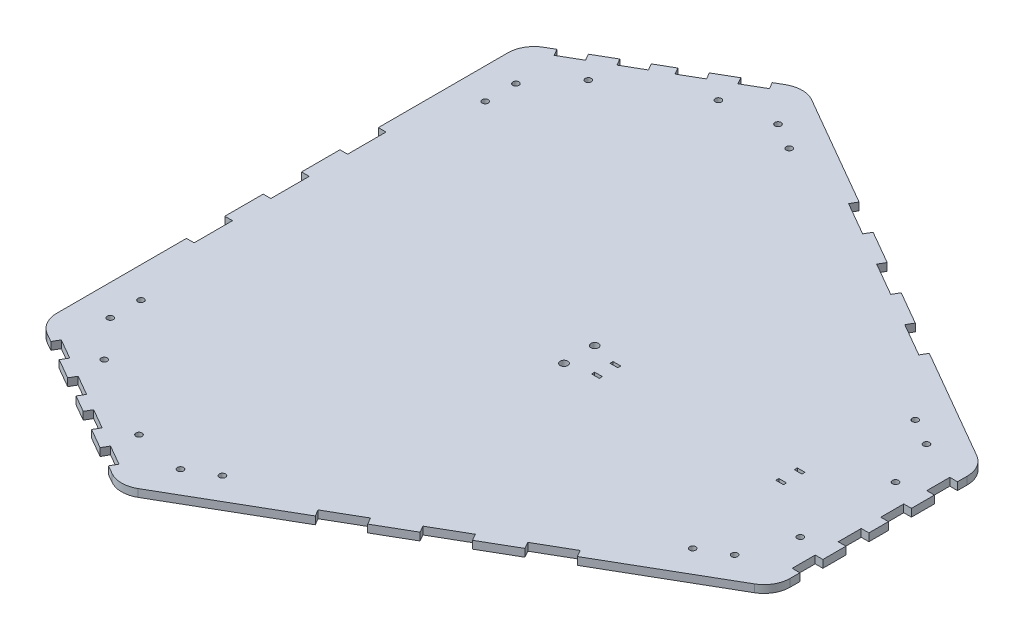
from build123d import *

# Parameters (mm, degrees)
STOCK_FRAME_START              = 460
STOCK_FRAME_MASTER_1_OUTLINE_R = 2
STOCK_FRAME_MASTER_1_DEPTH     = 5
SKETCH4_R                      = 2
CUT_EXTRUDE3_DEPTH             = 262.655447486
SKETCH1_R                      = 2.5
CUT_EXTRUDE1_DEPTH             = 313.332847009
SKETCH2_W                      = 5
SKETCH2_H                      = 2
CUT_EXTRUDE2_DEPTH             = 313.332847009


# Read off the part's stored shape, not the designer's step: Stock-Frame master-1
with BuildPart() as part:
    # Stock-Frame master-1 outline → Stock-Frame master-1 (new body)
    with BuildSketch(Plane(origin=(0, 0, 0), x_dir=(1, 0, 0), z_dir=(0, 1, 0)).offset(STOCK_FRAME_START)):
        with BuildLine():
            Line((220, 51.342522712), (220, 57.685045424))
            ThreePointArc((220, 57.685045424), (217.722431864, 66.185045424), (211.5, 72.407477288))
            Line((211.5, 72.407477288), (138.354945114, 114.637794416))
            Line((138.354945114, 114.637794416), (135.854945114, 110.307667397))
            Line((135.854945114, 110.307667397), (114.20431002, 122.807667397))
            Line((114.20431002, 122.807667397), (116.70431002, 127.137794416))
            Line((116.70431002, 127.137794416), (95.053674925, 139.637794416))
            Line((95.053674925, 139.637794416), (92.553674925, 135.307667397))
            Line((92.553674925, 135.307667397), (81.728357378, 141.557667397))
            Line((81.728357378, 141.557667397), (0, 0))
            Line((0, 0), (220, 0))
            Line((220, 0), (220, 6.342522712))
            Line((220, 6.342522712), (215, 6.342522712))
            Line((215, 6.342522712), (215, 21.342522712))
            Line((215, 21.342522712), (220, 21.342522712))
            Line((220, 21.342522712), (220, 36.342522712))
            Line((220, 36.342522712), (215, 36.342522712))
            Line((215, 36.342522712), (215, 51.342522712))
            Line((215, 51.342522712), (220, 51.342522712))
        make_face()
        with Locations((188.660254038, 62.5)):
            Circle(STOCK_FRAME_MASTER_1_OUTLINE_R, mode=Mode.SUBTRACT)
        with Locations((171.339745962, 72.5)):
            Circle(STOCK_FRAME_MASTER_1_OUTLINE_R, mode=Mode.SUBTRACT)
    extrude(amount=STOCK_FRAME_MASTER_1_DEPTH)

    # Sketch4 → Cut-Extrude3 (cut, through all)
    with BuildSketch(Plane(origin=(0, 465, 0), x_dir=(1, 0, 0), z_dir=(0, 1, 0))):
        with Locations(Location((200, 31, 0), (0, 0, 270))):
            Circle(SKETCH4_R)
    extrude(amount=-CUT_EXTRUDE3_DEPTH, mode=Mode.SUBTRACT)

    # Mirror1: part across plane


with BuildPart() as part_1:
    add(part.part)
    add(part.part.mirror(Plane(origin=(0, 465, 0), x_dir=(1, 0, 0), z_dir=(0, 0, -1))))


with BuildPart() as body_2:
    # Mirror2: mirrored copy
    add(part_1.part.mirror(Plane(origin=(81.728357378, 465, -141.557667397), x_dir=(-0.49999999999999395, 0, 0.866025403784442), z_dir=(0.8660254037844421, 0, 0.49999999999999395))))


with BuildPart() as body_3:
    # Mirror3: mirrored copy
    add(part_1.part.mirror(Plane(origin=(81.728357378, 465, 141.557667397), x_dir=(0.49999999999999395, 0, 0.866025403784442), z_dir=(0.8660254037844421, 0, -0.49999999999999395))))

    # Combine1: union body 2, part
    add(body_2.part)
    add(part_1.part)

    # Sketch1 → Cut-Extrude1 (cut, through all)
    with BuildSketch(Plane(origin=(0, 465, 0), x_dir=(1, 0, 0), z_dir=(0, 1, 0))):
        with Locations(Location((25, 10, 0), (0, 0, 270))):
            Circle(SKETCH1_R)
        with Locations(Location((25, -10, 0), (0, 0, 270))):
            Circle(SKETCH1_R)
    extrude(amount=-CUT_EXTRUDE1_DEPTH, mode=Mode.SUBTRACT)

    # Sketch2 → Cut-Extrude2 (cut, through all)
    with BuildSketch(Plane(origin=(0, 465, 0), x_dir=(1, 0, 0), z_dir=(0, 1, 0))):
        with Locations((42.5, 6)):
            Rectangle(SKETCH2_W, SKETCH2_H)
        with Locations((42.5, -6)):
            Rectangle(SKETCH2_W, SKETCH2_H)
        with Locations((162.5, 6)):
            Rectangle(SKETCH2_W, SKETCH2_H)
        with Locations((162.5, -6)):
            Rectangle(SKETCH2_W, SKETCH2_H)
    extrude(amount=-CUT_EXTRUDE2_DEPTH, mode=Mode.SUBTRACT)


solid = body_3.part
